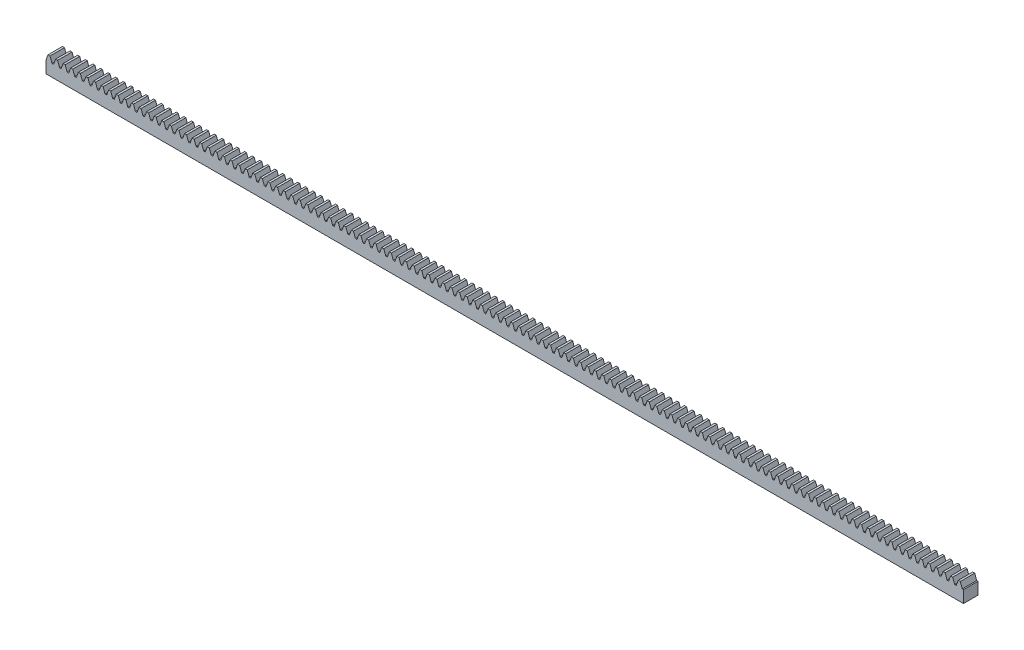
from build123d import *

# Parameters (mm, degrees)
SKETCH_1_W             = 760
SKETCH_1_H             = 10
EXTRUDE_1_DEPTH        = 12
EXTRUDE_2_DEPTH        = 12
PATTERN_LINEAR_1_COUNT = 121
PATTERN_LINEAR_1_PITCH = 6.283185307
PATTERN_LINEAR_4_COUNT = 6
PATTERN_LINEAR_4_PITCH = 50


with BuildPart() as part:
    # 草图1 → 拉伸1 (new body)
    with BuildSketch(Plane.XY):
        with Locations((380, -5)):
            Rectangle(SKETCH_1_W, SKETCH_1_H)
    extrude(amount=EXTRUDE_1_DEPTH)

    # 草图2 → 拉伸2 (add)
    with BuildSketch(Plane.XY.offset(12)):
        Polygon((0, 0), (1.637866054, 4.5), (3.323577771, 4.5), (4.961443825, 0), align=None)
    extrude_2 = extrude(amount=-EXTRUDE_2_DEPTH)

    # 阵列(线性)1: 拉伸2 ×121
    with Locations(*[(i * PATTERN_LINEAR_1_PITCH, 0, 0) for i in range(1, PATTERN_LINEAR_1_COUNT)]):
        add(extrude_2)

    # 草图22 → M6 螺纹孔3 (revolve, cut)
    with BuildSketch(Plane(origin=(276.460153516, -10, 6.222189373), x_dir=(0, 0, -1), z_dir=(1, 0, 0))):
        Polygon((0, 0), (0, 8.502151548), (2.5, 7), (2.5, 0), align=None)
    hole_wizard_m6_3 = revolve(axis=Axis((276.460153516, -16.35, 6.222189373), (0, 1, 0)), mode=Mode.SUBTRACT)

    # 阵列(线性)4: M6 螺纹孔3 ×6
    with Locations(*[(-i * PATTERN_LINEAR_4_PITCH, 0, 0) for i in range(1, PATTERN_LINEAR_4_COUNT)]):
        add(hole_wizard_m6_3, mode=Mode.SUBTRACT)

    # 阵列(线性)5 copy 1 sketch → 阵列(线性)5 copy 1 (revolve, cut)
    with BuildSketch(Plane(origin=(276.460153516, -10, 6.222189373), x_dir=(0, 0, -1), z_dir=(1, 0, 0))):
        Polygon((0, 0), (0, 8.502151548), (2.5, 7), (2.5, 0), align=None)
    revolve(axis=Axis((276.460153516, -16.35, 6.222189373), (0, 1, 0)), mode=Mode.SUBTRACT)

    # 阵列(线性)5 copy 2 sketch → 阵列(线性)5 copy 2 (revolve, cut)
    with BuildSketch(Plane(origin=(326.460153516, -10, 6.222189373), x_dir=(0, 0, -1), z_dir=(1, 0, 0))):
        Polygon((0, 0), (0, 8.502151548), (2.5, 7), (2.5, 0), align=None)
    revolve(axis=Axis((326.460153516, -16.35, 6.222189373), (0, 1, 0)), mode=Mode.SUBTRACT)

    # 阵列(线性)5 copy 3 sketch → 阵列(线性)5 copy 3 (revolve, cut)
    with BuildSketch(Plane(origin=(376.460153516, -10, 6.222189373), x_dir=(0, 0, -1), z_dir=(1, 0, 0))):
        Polygon((0, 0), (0, 8.502151548), (2.5, 7), (2.5, 0), align=None)
    revolve(axis=Axis((376.460153516, -16.35, 6.222189373), (0, 1, 0)), mode=Mode.SUBTRACT)

    # 阵列(线性)5 copy 4 sketch → 阵列(线性)5 copy 4 (revolve, cut)
    with BuildSketch(Plane(origin=(426.460153516, -10, 6.222189373), x_dir=(0, 0, -1), z_dir=(1, 0, 0))):
        Polygon((0, 0), (0, 8.502151548), (2.5, 7), (2.5, 0), align=None)
    revolve(axis=Axis((426.460153516, -16.35, 6.222189373), (0, 1, 0)), mode=Mode.SUBTRACT)

    # 阵列(线性)5 copy 5 sketch → 阵列(线性)5 copy 5 (revolve, cut)
    with BuildSketch(Plane(origin=(476.460153516, -10, 6.222189373), x_dir=(0, 0, -1), z_dir=(1, 0, 0))):
        Polygon((0, 0), (0, 8.502151548), (2.5, 7), (2.5, 0), align=None)
    revolve(axis=Axis((476.460153516, -16.35, 6.222189373), (0, 1, 0)), mode=Mode.SUBTRACT)

    # 阵列(线性)5 copy 6 sketch → 阵列(线性)5 copy 6 (revolve, cut)
    with BuildSketch(Plane(origin=(526.460153516, -10, 6.222189373), x_dir=(0, 0, -1), z_dir=(1, 0, 0))):
        Polygon((0, 0), (0, 8.502151548), (2.5, 7), (2.5, 0), align=None)
    revolve(axis=Axis((526.460153516, -16.35, 6.222189373), (0, 1, 0)), mode=Mode.SUBTRACT)

    # 阵列(线性)5 copy 7 sketch → 阵列(线性)5 copy 7 (revolve, cut)
    with BuildSketch(Plane(origin=(576.460153516, -10, 6.222189373), x_dir=(0, 0, -1), z_dir=(1, 0, 0))):
        Polygon((0, 0), (0, 8.502151548), (2.5, 7), (2.5, 0), align=None)
    revolve(axis=Axis((576.460153516, -16.35, 6.222189373), (0, 1, 0)), mode=Mode.SUBTRACT)

    # 阵列(线性)5 copy 8 sketch → 阵列(线性)5 copy 8 (revolve, cut)
    with BuildSketch(Plane(origin=(626.460153516, -10, 6.222189373), x_dir=(0, 0, -1), z_dir=(1, 0, 0))):
        Polygon((0, 0), (0, 8.502151548), (2.5, 7), (2.5, 0), align=None)
    revolve(axis=Axis((626.460153516, -16.35, 6.222189373), (0, 1, 0)), mode=Mode.SUBTRACT)

    # 阵列(线性)5 copy 9 sketch → 阵列(线性)5 copy 9 (revolve, cut)
    with BuildSketch(Plane(origin=(676.460153516, -10, 6.222189373), x_dir=(0, 0, -1), z_dir=(1, 0, 0))):
        Polygon((0, 0), (0, 8.502151548), (2.5, 7), (2.5, 0), align=None)
    revolve(axis=Axis((676.460153516, -16.35, 6.222189373), (0, 1, 0)), mode=Mode.SUBTRACT)

    # 阵列(线性)5 copy 10 sketch → 阵列(线性)5 copy 10 (revolve, cut)
    with BuildSketch(Plane(origin=(226.460153516, -10, 6.222189373), x_dir=(0, 0, -1), z_dir=(1, 0, 0))):
        Polygon((0, 0), (0, 8.502151548), (2.5, 7), (2.5, 0), align=None)
    revolve(axis=Axis((226.460153516, -16.35, 6.222189373), (0, 1, 0)), mode=Mode.SUBTRACT)

    # 阵列(线性)5 copy 11 sketch → 阵列(线性)5 copy 11 (revolve, cut)
    with BuildSketch(Plane(origin=(276.460153516, -10, 6.222189373), x_dir=(0, 0, -1), z_dir=(1, 0, 0))):
        Polygon((0, 0), (0, 8.502151548), (2.5, 7), (2.5, 0), align=None)
    revolve(axis=Axis((276.460153516, -16.35, 6.222189373), (0, 1, 0)), mode=Mode.SUBTRACT)

    # 阵列(线性)5 copy 12 sketch → 阵列(线性)5 copy 12 (revolve, cut)
    with BuildSketch(Plane(origin=(326.460153516, -10, 6.222189373), x_dir=(0, 0, -1), z_dir=(1, 0, 0))):
        Polygon((0, 0), (0, 8.502151548), (2.5, 7), (2.5, 0), align=None)
    revolve(axis=Axis((326.460153516, -16.35, 6.222189373), (0, 1, 0)), mode=Mode.SUBTRACT)

    # 阵列(线性)5 copy 13 sketch → 阵列(线性)5 copy 13 (revolve, cut)
    with BuildSketch(Plane(origin=(376.460153516, -10, 6.222189373), x_dir=(0, 0, -1), z_dir=(1, 0, 0))):
        Polygon((0, 0), (0, 8.502151548), (2.5, 7), (2.5, 0), align=None)
    revolve(axis=Axis((376.460153516, -16.35, 6.222189373), (0, 1, 0)), mode=Mode.SUBTRACT)

    # 阵列(线性)5 copy 14 sketch → 阵列(线性)5 copy 14 (revolve, cut)
    with BuildSketch(Plane(origin=(426.460153516, -10, 6.222189373), x_dir=(0, 0, -1), z_dir=(1, 0, 0))):
        Polygon((0, 0), (0, 8.502151548), (2.5, 7), (2.5, 0), align=None)
    revolve(axis=Axis((426.460153516, -16.35, 6.222189373), (0, 1, 0)), mode=Mode.SUBTRACT)

    # 阵列(线性)5 copy 15 sketch → 阵列(线性)5 copy 15 (revolve, cut)
    with BuildSketch(Plane(origin=(476.460153516, -10, 6.222189373), x_dir=(0, 0, -1), z_dir=(1, 0, 0))):
        Polygon((0, 0), (0, 8.502151548), (2.5, 7), (2.5, 0), align=None)
    revolve(axis=Axis((476.460153516, -16.35, 6.222189373), (0, 1, 0)), mode=Mode.SUBTRACT)

    # 阵列(线性)5 copy 16 sketch → 阵列(线性)5 copy 16 (revolve, cut)
    with BuildSketch(Plane(origin=(526.460153516, -10, 6.222189373), x_dir=(0, 0, -1), z_dir=(1, 0, 0))):
        Polygon((0, 0), (0, 8.502151548), (2.5, 7), (2.5, 0), align=None)
    revolve(axis=Axis((526.460153516, -16.35, 6.222189373), (0, 1, 0)), mode=Mode.SUBTRACT)

    # 阵列(线性)5 copy 17 sketch → 阵列(线性)5 copy 17 (revolve, cut)
    with BuildSketch(Plane(origin=(576.460153516, -10, 6.222189373), x_dir=(0, 0, -1), z_dir=(1, 0, 0))):
        Polygon((0, 0), (0, 8.502151548), (2.5, 7), (2.5, 0), align=None)
    revolve(axis=Axis((576.460153516, -16.35, 6.222189373), (0, 1, 0)), mode=Mode.SUBTRACT)

    # 阵列(线性)5 copy 18 sketch → 阵列(线性)5 copy 18 (revolve, cut)
    with BuildSketch(Plane(origin=(626.460153516, -10, 6.222189373), x_dir=(0, 0, -1), z_dir=(1, 0, 0))):
        Polygon((0, 0), (0, 8.502151548), (2.5, 7), (2.5, 0), align=None)
    revolve(axis=Axis((626.460153516, -16.35, 6.222189373), (0, 1, 0)), mode=Mode.SUBTRACT)

    # 阵列(线性)5 copy 19 sketch → 阵列(线性)5 copy 19 (revolve, cut)
    with BuildSketch(Plane(origin=(176.460153516, -10, 6.222189373), x_dir=(0, 0, -1), z_dir=(1, 0, 0))):
        Polygon((0, 0), (0, 8.502151548), (2.5, 7), (2.5, 0), align=None)
    revolve(axis=Axis((176.460153516, -16.35, 6.222189373), (0, 1, 0)), mode=Mode.SUBTRACT)

    # 阵列(线性)5 copy 20 sketch → 阵列(线性)5 copy 20 (revolve, cut)
    with BuildSketch(Plane(origin=(226.460153516, -10, 6.222189373), x_dir=(0, 0, -1), z_dir=(1, 0, 0))):
        Polygon((0, 0), (0, 8.502151548), (2.5, 7), (2.5, 0), align=None)
    revolve(axis=Axis((226.460153516, -16.35, 6.222189373), (0, 1, 0)), mode=Mode.SUBTRACT)

    # 阵列(线性)5 copy 21 sketch → 阵列(线性)5 copy 21 (revolve, cut)
    with BuildSketch(Plane(origin=(276.460153516, -10, 6.222189373), x_dir=(0, 0, -1), z_dir=(1, 0, 0))):
        Polygon((0, 0), (0, 8.502151548), (2.5, 7), (2.5, 0), align=None)
    revolve(axis=Axis((276.460153516, -16.35, 6.222189373), (0, 1, 0)), mode=Mode.SUBTRACT)

    # 阵列(线性)5 copy 22 sketch → 阵列(线性)5 copy 22 (revolve, cut)
    with BuildSketch(Plane(origin=(326.460153516, -10, 6.222189373), x_dir=(0, 0, -1), z_dir=(1, 0, 0))):
        Polygon((0, 0), (0, 8.502151548), (2.5, 7), (2.5, 0), align=None)
    revolve(axis=Axis((326.460153516, -16.35, 6.222189373), (0, 1, 0)), mode=Mode.SUBTRACT)

    # 阵列(线性)5 copy 23 sketch → 阵列(线性)5 copy 23 (revolve, cut)
    with BuildSketch(Plane(origin=(376.460153516, -10, 6.222189373), x_dir=(0, 0, -1), z_dir=(1, 0, 0))):
        Polygon((0, 0), (0, 8.502151548), (2.5, 7), (2.5, 0), align=None)
    revolve(axis=Axis((376.460153516, -16.35, 6.222189373), (0, 1, 0)), mode=Mode.SUBTRACT)

    # 阵列(线性)5 copy 24 sketch → 阵列(线性)5 copy 24 (revolve, cut)
    with BuildSketch(Plane(origin=(426.460153516, -10, 6.222189373), x_dir=(0, 0, -1), z_dir=(1, 0, 0))):
        Polygon((0, 0), (0, 8.502151548), (2.5, 7), (2.5, 0), align=None)
    revolve(axis=Axis((426.460153516, -16.35, 6.222189373), (0, 1, 0)), mode=Mode.SUBTRACT)

    # 阵列(线性)5 copy 25 sketch → 阵列(线性)5 copy 25 (revolve, cut)
    with BuildSketch(Plane(origin=(476.460153516, -10, 6.222189373), x_dir=(0, 0, -1), z_dir=(1, 0, 0))):
        Polygon((0, 0), (0, 8.502151548), (2.5, 7), (2.5, 0), align=None)
    revolve(axis=Axis((476.460153516, -16.35, 6.222189373), (0, 1, 0)), mode=Mode.SUBTRACT)

    # 阵列(线性)5 copy 26 sketch → 阵列(线性)5 copy 26 (revolve, cut)
    with BuildSketch(Plane(origin=(526.460153516, -10, 6.222189373), x_dir=(0, 0, -1), z_dir=(1, 0, 0))):
        Polygon((0, 0), (0, 8.502151548), (2.5, 7), (2.5, 0), align=None)
    revolve(axis=Axis((526.460153516, -16.35, 6.222189373), (0, 1, 0)), mode=Mode.SUBTRACT)

    # 阵列(线性)5 copy 27 sketch → 阵列(线性)5 copy 27 (revolve, cut)
    with BuildSketch(Plane(origin=(576.460153516, -10, 6.222189373), x_dir=(0, 0, -1), z_dir=(1, 0, 0))):
        Polygon((0, 0), (0, 8.502151548), (2.5, 7), (2.5, 0), align=None)
    revolve(axis=Axis((576.460153516, -16.35, 6.222189373), (0, 1, 0)), mode=Mode.SUBTRACT)

    # 阵列(线性)5 copy 28 sketch → 阵列(线性)5 copy 28 (revolve, cut)
    with BuildSketch(Plane(origin=(126.460153516, -10, 6.222189373), x_dir=(0, 0, -1), z_dir=(1, 0, 0))):
        Polygon((0, 0), (0, 8.502151548), (2.5, 7), (2.5, 0), align=None)
    revolve(axis=Axis((126.460153516, -16.35, 6.222189373), (0, 1, 0)), mode=Mode.SUBTRACT)

    # 阵列(线性)5 copy 29 sketch → 阵列(线性)5 copy 29 (revolve, cut)
    with BuildSketch(Plane(origin=(176.460153516, -10, 6.222189373), x_dir=(0, 0, -1), z_dir=(1, 0, 0))):
        Polygon((0, 0), (0, 8.502151548), (2.5, 7), (2.5, 0), align=None)
    revolve(axis=Axis((176.460153516, -16.35, 6.222189373), (0, 1, 0)), mode=Mode.SUBTRACT)

    # 阵列(线性)5 copy 30 sketch → 阵列(线性)5 copy 30 (revolve, cut)
    with BuildSketch(Plane(origin=(226.460153516, -10, 6.222189373), x_dir=(0, 0, -1), z_dir=(1, 0, 0))):
        Polygon((0, 0), (0, 8.502151548), (2.5, 7), (2.5, 0), align=None)
    revolve(axis=Axis((226.460153516, -16.35, 6.222189373), (0, 1, 0)), mode=Mode.SUBTRACT)

    # 阵列(线性)5 copy 31 sketch → 阵列(线性)5 copy 31 (revolve, cut)
    with BuildSketch(Plane(origin=(276.460153516, -10, 6.222189373), x_dir=(0, 0, -1), z_dir=(1, 0, 0))):
        Polygon((0, 0), (0, 8.502151548), (2.5, 7), (2.5, 0), align=None)
    revolve(axis=Axis((276.460153516, -16.35, 6.222189373), (0, 1, 0)), mode=Mode.SUBTRACT)

    # 阵列(线性)5 copy 32 sketch → 阵列(线性)5 copy 32 (revolve, cut)
    with BuildSketch(Plane(origin=(326.460153516, -10, 6.222189373), x_dir=(0, 0, -1), z_dir=(1, 0, 0))):
        Polygon((0, 0), (0, 8.502151548), (2.5, 7), (2.5, 0), align=None)
    revolve(axis=Axis((326.460153516, -16.35, 6.222189373), (0, 1, 0)), mode=Mode.SUBTRACT)

    # 阵列(线性)5 copy 33 sketch → 阵列(线性)5 copy 33 (revolve, cut)
    with BuildSketch(Plane(origin=(376.460153516, -10, 6.222189373), x_dir=(0, 0, -1), z_dir=(1, 0, 0))):
        Polygon((0, 0), (0, 8.502151548), (2.5, 7), (2.5, 0), align=None)
    revolve(axis=Axis((376.460153516, -16.35, 6.222189373), (0, 1, 0)), mode=Mode.SUBTRACT)

    # 阵列(线性)5 copy 34 sketch → 阵列(线性)5 copy 34 (revolve, cut)
    with BuildSketch(Plane(origin=(426.460153516, -10, 6.222189373), x_dir=(0, 0, -1), z_dir=(1, 0, 0))):
        Polygon((0, 0), (0, 8.502151548), (2.5, 7), (2.5, 0), align=None)
    revolve(axis=Axis((426.460153516, -16.35, 6.222189373), (0, 1, 0)), mode=Mode.SUBTRACT)

    # 阵列(线性)5 copy 35 sketch → 阵列(线性)5 copy 35 (revolve, cut)
    with BuildSketch(Plane(origin=(476.460153516, -10, 6.222189373), x_dir=(0, 0, -1), z_dir=(1, 0, 0))):
        Polygon((0, 0), (0, 8.502151548), (2.5, 7), (2.5, 0), align=None)
    revolve(axis=Axis((476.460153516, -16.35, 6.222189373), (0, 1, 0)), mode=Mode.SUBTRACT)

    # 阵列(线性)5 copy 36 sketch → 阵列(线性)5 copy 36 (revolve, cut)
    with BuildSketch(Plane(origin=(526.460153516, -10, 6.222189373), x_dir=(0, 0, -1), z_dir=(1, 0, 0))):
        Polygon((0, 0), (0, 8.502151548), (2.5, 7), (2.5, 0), align=None)
    revolve(axis=Axis((526.460153516, -16.35, 6.222189373), (0, 1, 0)), mode=Mode.SUBTRACT)

    # 阵列(线性)5 copy 37 sketch → 阵列(线性)5 copy 37 (revolve, cut)
    with BuildSketch(Plane(origin=(76.460153516, -10, 6.222189373), x_dir=(0, 0, -1), z_dir=(1, 0, 0))):
        Polygon((0, 0), (0, 8.502151548), (2.5, 7), (2.5, 0), align=None)
    revolve(axis=Axis((76.460153516, -16.35, 6.222189373), (0, 1, 0)), mode=Mode.SUBTRACT)

    # 阵列(线性)5 copy 38 sketch → 阵列(线性)5 copy 38 (revolve, cut)
    with BuildSketch(Plane(origin=(126.460153516, -10, 6.222189373), x_dir=(0, 0, -1), z_dir=(1, 0, 0))):
        Polygon((0, 0), (0, 8.502151548), (2.5, 7), (2.5, 0), align=None)
    revolve(axis=Axis((126.460153516, -16.35, 6.222189373), (0, 1, 0)), mode=Mode.SUBTRACT)

    # 阵列(线性)5 copy 39 sketch → 阵列(线性)5 copy 39 (revolve, cut)
    with BuildSketch(Plane(origin=(176.460153516, -10, 6.222189373), x_dir=(0, 0, -1), z_dir=(1, 0, 0))):
        Polygon((0, 0), (0, 8.502151548), (2.5, 7), (2.5, 0), align=None)
    revolve(axis=Axis((176.460153516, -16.35, 6.222189373), (0, 1, 0)), mode=Mode.SUBTRACT)

    # 阵列(线性)5 copy 40 sketch → 阵列(线性)5 copy 40 (revolve, cut)
    with BuildSketch(Plane(origin=(226.460153516, -10, 6.222189373), x_dir=(0, 0, -1), z_dir=(1, 0, 0))):
        Polygon((0, 0), (0, 8.502151548), (2.5, 7), (2.5, 0), align=None)
    revolve(axis=Axis((226.460153516, -16.35, 6.222189373), (0, 1, 0)), mode=Mode.SUBTRACT)

    # 阵列(线性)5 copy 41 sketch → 阵列(线性)5 copy 41 (revolve, cut)
    with BuildSketch(Plane(origin=(276.460153516, -10, 6.222189373), x_dir=(0, 0, -1), z_dir=(1, 0, 0))):
        Polygon((0, 0), (0, 8.502151548), (2.5, 7), (2.5, 0), align=None)
    revolve(axis=Axis((276.460153516, -16.35, 6.222189373), (0, 1, 0)), mode=Mode.SUBTRACT)

    # 阵列(线性)5 copy 42 sketch → 阵列(线性)5 copy 42 (revolve, cut)
    with BuildSketch(Plane(origin=(326.460153516, -10, 6.222189373), x_dir=(0, 0, -1), z_dir=(1, 0, 0))):
        Polygon((0, 0), (0, 8.502151548), (2.5, 7), (2.5, 0), align=None)
    revolve(axis=Axis((326.460153516, -16.35, 6.222189373), (0, 1, 0)), mode=Mode.SUBTRACT)

    # 阵列(线性)5 copy 43 sketch → 阵列(线性)5 copy 43 (revolve, cut)
    with BuildSketch(Plane(origin=(376.460153516, -10, 6.222189373), x_dir=(0, 0, -1), z_dir=(1, 0, 0))):
        Polygon((0, 0), (0, 8.502151548), (2.5, 7), (2.5, 0), align=None)
    revolve(axis=Axis((376.460153516, -16.35, 6.222189373), (0, 1, 0)), mode=Mode.SUBTRACT)

    # 阵列(线性)5 copy 44 sketch → 阵列(线性)5 copy 44 (revolve, cut)
    with BuildSketch(Plane(origin=(426.460153516, -10, 6.222189373), x_dir=(0, 0, -1), z_dir=(1, 0, 0))):
        Polygon((0, 0), (0, 8.502151548), (2.5, 7), (2.5, 0), align=None)
    revolve(axis=Axis((426.460153516, -16.35, 6.222189373), (0, 1, 0)), mode=Mode.SUBTRACT)

    # 阵列(线性)5 copy 45 sketch → 阵列(线性)5 copy 45 (revolve, cut)
    with BuildSketch(Plane(origin=(476.460153516, -10, 6.222189373), x_dir=(0, 0, -1), z_dir=(1, 0, 0))):
        Polygon((0, 0), (0, 8.502151548), (2.5, 7), (2.5, 0), align=None)
    revolve(axis=Axis((476.460153516, -16.35, 6.222189373), (0, 1, 0)), mode=Mode.SUBTRACT)

    # 阵列(线性)5 copy 46 sketch → 阵列(线性)5 copy 46 (revolve, cut)
    with BuildSketch(Plane(origin=(326.460153516, -10, 6.222189373), x_dir=(0, 0, -1), z_dir=(1, 0, 0))):
        Polygon((0, 0), (0, 8.502151548), (2.5, 7), (2.5, 0), align=None)
    revolve(axis=Axis((326.460153516, -16.35, 6.222189373), (0, 1, 0)), mode=Mode.SUBTRACT)

    # 阵列(线性)5 copy 47 sketch → 阵列(线性)5 copy 47 (revolve, cut)
    with BuildSketch(Plane(origin=(376.460153516, -10, 6.222189373), x_dir=(0, 0, -1), z_dir=(1, 0, 0))):
        Polygon((0, 0), (0, 8.502151548), (2.5, 7), (2.5, 0), align=None)
    revolve(axis=Axis((376.460153516, -16.35, 6.222189373), (0, 1, 0)), mode=Mode.SUBTRACT)

    # 阵列(线性)5 copy 48 sketch → 阵列(线性)5 copy 48 (revolve, cut)
    with BuildSketch(Plane(origin=(426.460153516, -10, 6.222189373), x_dir=(0, 0, -1), z_dir=(1, 0, 0))):
        Polygon((0, 0), (0, 8.502151548), (2.5, 7), (2.5, 0), align=None)
    revolve(axis=Axis((426.460153516, -16.35, 6.222189373), (0, 1, 0)), mode=Mode.SUBTRACT)

    # 阵列(线性)5 copy 49 sketch → 阵列(线性)5 copy 49 (revolve, cut)
    with BuildSketch(Plane(origin=(476.460153516, -10, 6.222189373), x_dir=(0, 0, -1), z_dir=(1, 0, 0))):
        Polygon((0, 0), (0, 8.502151548), (2.5, 7), (2.5, 0), align=None)
    revolve(axis=Axis((476.460153516, -16.35, 6.222189373), (0, 1, 0)), mode=Mode.SUBTRACT)

    # 阵列(线性)5 copy 50 sketch → 阵列(线性)5 copy 50 (revolve, cut)
    with BuildSketch(Plane(origin=(526.460153516, -10, 6.222189373), x_dir=(0, 0, -1), z_dir=(1, 0, 0))):
        Polygon((0, 0), (0, 8.502151548), (2.5, 7), (2.5, 0), align=None)
    revolve(axis=Axis((526.460153516, -16.35, 6.222189373), (0, 1, 0)), mode=Mode.SUBTRACT)

    # 阵列(线性)5 copy 51 sketch → 阵列(线性)5 copy 51 (revolve, cut)
    with BuildSketch(Plane(origin=(576.460153516, -10, 6.222189373), x_dir=(0, 0, -1), z_dir=(1, 0, 0))):
        Polygon((0, 0), (0, 8.502151548), (2.5, 7), (2.5, 0), align=None)
    revolve(axis=Axis((576.460153516, -16.35, 6.222189373), (0, 1, 0)), mode=Mode.SUBTRACT)

    # 阵列(线性)5 copy 52 sketch → 阵列(线性)5 copy 52 (revolve, cut)
    with BuildSketch(Plane(origin=(626.460153516, -10, 6.222189373), x_dir=(0, 0, -1), z_dir=(1, 0, 0))):
        Polygon((0, 0), (0, 8.502151548), (2.5, 7), (2.5, 0), align=None)
    revolve(axis=Axis((626.460153516, -16.35, 6.222189373), (0, 1, 0)), mode=Mode.SUBTRACT)

    # 阵列(线性)5 copy 53 sketch → 阵列(线性)5 copy 53 (revolve, cut)
    with BuildSketch(Plane(origin=(676.460153516, -10, 6.222189373), x_dir=(0, 0, -1), z_dir=(1, 0, 0))):
        Polygon((0, 0), (0, 8.502151548), (2.5, 7), (2.5, 0), align=None)
    revolve(axis=Axis((676.460153516, -16.35, 6.222189373), (0, 1, 0)), mode=Mode.SUBTRACT)

    # 阵列(线性)5 copy 54 sketch → 阵列(线性)5 copy 54 (revolve, cut)
    with BuildSketch(Plane(origin=(726.460153516, -10, 6.222189373), x_dir=(0, 0, -1), z_dir=(1, 0, 0))):
        Polygon((0, 0), (0, 8.502151548), (2.5, 7), (2.5, 0), align=None)
    revolve(axis=Axis((726.460153516, -16.35, 6.222189373), (0, 1, 0)), mode=Mode.SUBTRACT)


solid = part.part
